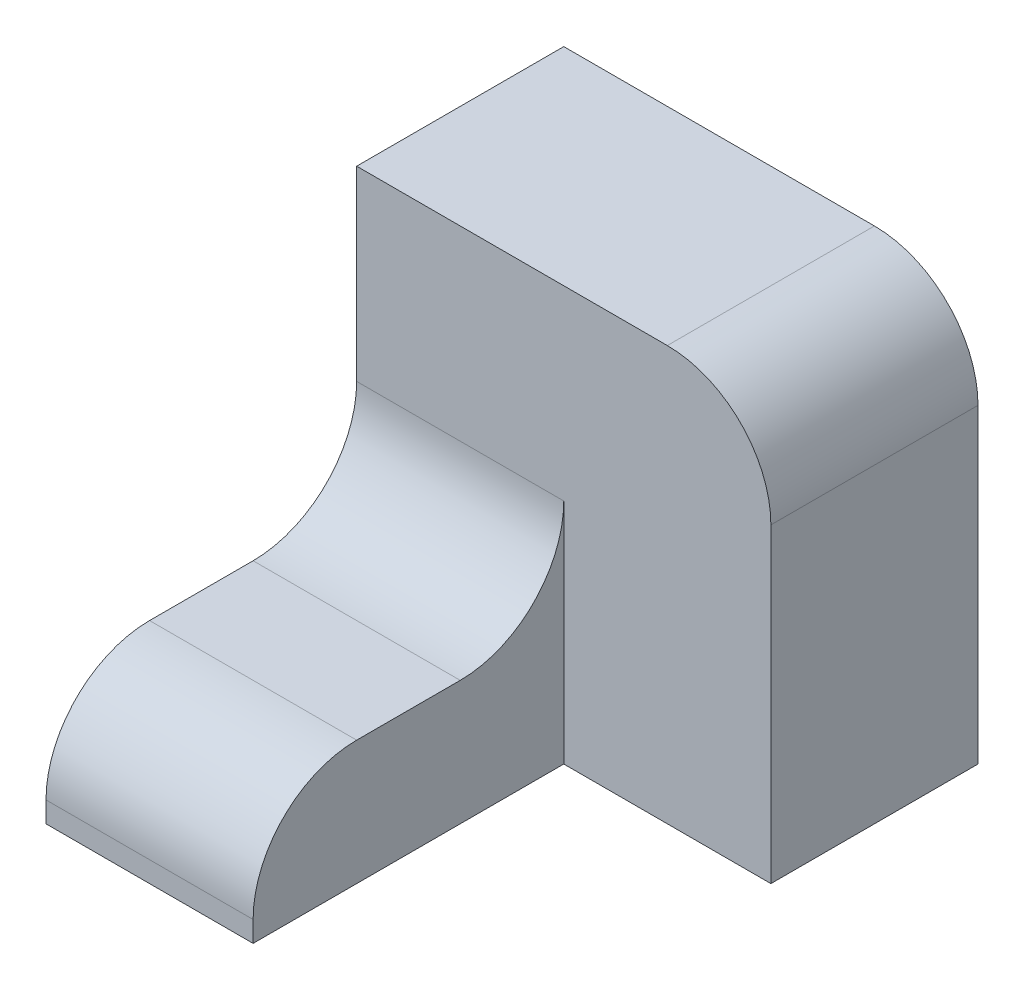
from build123d import *

# Parameters (mm, degrees)
SKETCH1_W           = 20
SKETCH1_H           = 12
BOSS_EXTRUDE1_DEPTH = 30
SKETCH2_W           = 40
SKETCH2_H           = 40
BOSS_EXTRUDE2_DEPTH = 20
FILLET1_R           = 10


with BuildPart() as part:
    # Sketch1 → Boss-Extrude1 (new body)
    with BuildSketch(Plane.XY):
        with Locations((-20, -6)):
            Rectangle(SKETCH1_W, SKETCH1_H)
    extrude(amount=BOSS_EXTRUDE1_DEPTH)

    # Sketch2 → Boss-Extrude2 (add)
    with BuildSketch(Plane.XY):
        with Locations((-10, 8)):
            Rectangle(SKETCH2_W, SKETCH2_H)
    extrude(amount=-BOSS_EXTRUDE2_DEPTH)

    # Fillet1
    fillet1_edges = [part.edges().sort_by_distance(p)[0] for p in [
        (-20, 0, 0),
        (10, 28, -10),
        (-20, 0, 30),
    ]]
    fillet(fillet1_edges, radius=FILLET1_R)


solid = part.part
